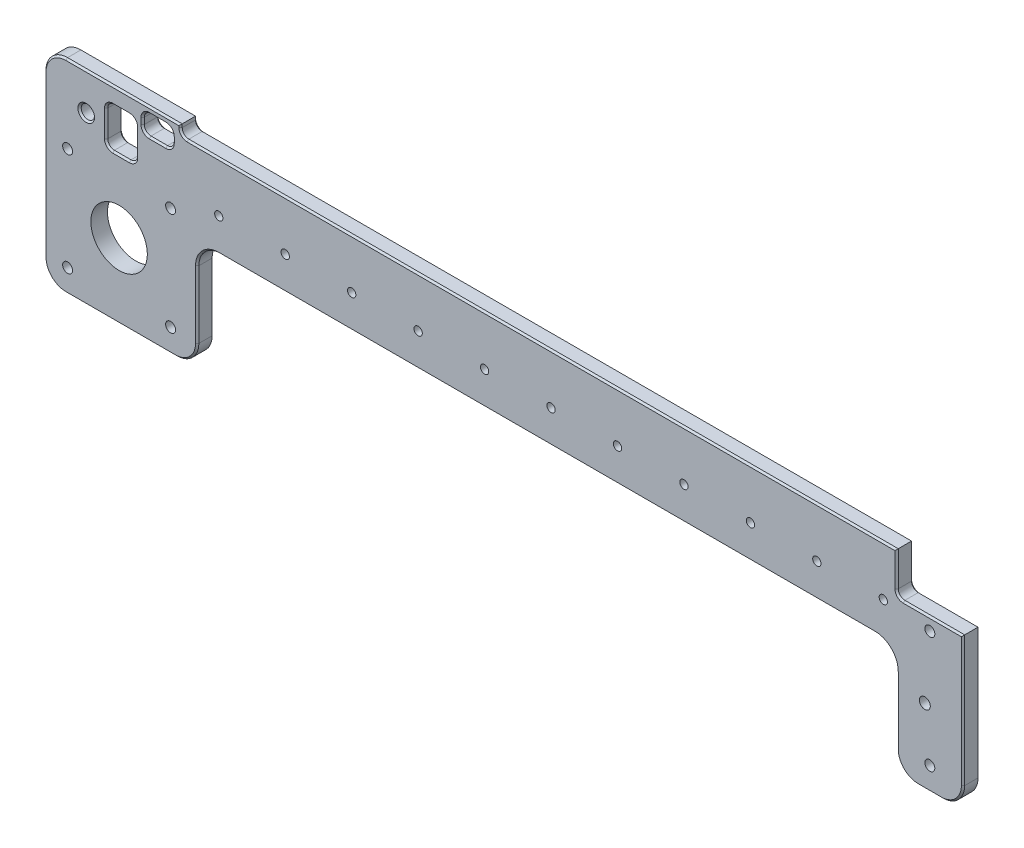
from build123d import *

# Parameters (mm, degrees)
SKETCH1_R           = 1.25
SKETCH1_R_2         = 8.5
SKETCH1_R_3         = 1.5
SKETCH1_R_4         = 1.65
SKETCH1_R_5         = 2
BOSS_EXTRUDE1_DEPTH = 5
CHAMFER1_SIZE       = 0.5


with BuildPart() as part:
    # Sketch1 → Boss-Extrude1 (new body)
    with BuildSketch(Plane.XY):
        with BuildLine():
            Line((0, -10), (197.5, -10))
            ThreePointArc((197.5, -10), (202.096194078, -11.903805922), (204, -16.5))
            Line((204, -16.5), (204, -36.746197724))
            ThreePointArc((204, -36.746197724), (205.903805922, -41.342391801), (210.5, -43.246197724))
            Line((210.5, -43.246197724), (217.5, -43.246197724))
            ThreePointArc((217.5, -43.246197724), (222.096194078, -41.342391801), (224, -36.746197724))
            Line((224, -36.746197724), (224, 2.55))
            Line((224, 2.55), (206, 2.55))
            ThreePointArc((206, 2.55), (204.585786438, 3.135786438), (204, 4.55))
            Line((204, 4.55), (204, 15))
            Line((204, 15), (-9.5, 15))
            ThreePointArc((-9.5, 15), (-10.914213562, 15.585786438), (-11.5, 17))
            Line((-11.5, 17), (-11.5, 18))
            Line((-11.5, 18), (-46, 18))
            ThreePointArc((-46, 18), (-50.596194078, 16.096194078), (-52.5, 11.5))
            Line((-52.5, 11.5), (-52.5, -36.746197724))
            ThreePointArc((-52.5, -36.746197724), (-50.596194078, -41.342391801), (-46, -43.246197724))
            Line((-46, -43.246197724), (-13, -43.246197724))
            ThreePointArc((-13, -43.246197724), (-8.403805922, -41.342391801), (-6.5, -36.746197724))
            Line((-6.5, -36.746197724), (-6.5, -16.5))
            ThreePointArc((-6.5, -16.5), (-4.596194078, -11.903805922), (0, -10))
        make_face()
        Circle(SKETCH1_R, mode=Mode.SUBTRACT)
        with Locations((20, 0)):
            Circle(SKETCH1_R, mode=Mode.SUBTRACT)
        with Locations((40, 0)):
            Circle(SKETCH1_R, mode=Mode.SUBTRACT)
        with Locations((60, 0)):
            Circle(SKETCH1_R, mode=Mode.SUBTRACT)
        with Locations((80, 0)):
            Circle(SKETCH1_R, mode=Mode.SUBTRACT)
        with Locations((100, 0)):
            Circle(SKETCH1_R, mode=Mode.SUBTRACT)
        with Locations((120, 0)):
            Circle(SKETCH1_R, mode=Mode.SUBTRACT)
        with Locations((140, 0)):
            Circle(SKETCH1_R, mode=Mode.SUBTRACT)
        with Locations((160, 0)):
            Circle(SKETCH1_R, mode=Mode.SUBTRACT)
        with Locations((180, 0)):
            Circle(SKETCH1_R, mode=Mode.SUBTRACT)
        with Locations((-30, -20.746197724)):
            Circle(SKETCH1_R_2, mode=Mode.SUBTRACT)
        with Locations((-45.5, -5.246197724)):
            Circle(SKETCH1_R_3, mode=Mode.SUBTRACT)
        with Locations((-14.5, -5.246197724)):
            Circle(SKETCH1_R_3, mode=Mode.SUBTRACT)
        with Locations((-45.5, -36.246197724)):
            Circle(SKETCH1_R_3, mode=Mode.SUBTRACT)
        with Locations((-14.5, -36.246197724)):
            Circle(SKETCH1_R_3, mode=Mode.SUBTRACT)
        with Locations((200, 0)):
            Circle(SKETCH1_R, mode=Mode.SUBTRACT)
        with Locations((212.5, -20.746197724)):
            Circle(SKETCH1_R_4, mode=Mode.SUBTRACT)
        with Locations((214, -36.246197724)):
            Circle(SKETCH1_R_3, mode=Mode.SUBTRACT)
        with Locations((214, -1.246197724)):
            Circle(SKETCH1_R_3, mode=Mode.SUBTRACT)
        with Locations((-39.9, 6.9)):
            Circle(SKETCH1_R_5, mode=Mode.SUBTRACT)
        with BuildLine():
            Line((-20.9, 16), (-15.9, 16))
            ThreePointArc((-15.9, 16), (-14.485786438, 15.414213562), (-13.9, 14))
            Line((-13.9, 14), (-13.9, 12.12))
            ThreePointArc((-13.9, 12.12), (-14.485786438, 10.705786438), (-15.9, 10.12))
            Line((-15.9, 10.12), (-20.9, 10.12))
            ThreePointArc((-20.9, 10.12), (-22.314213562, 10.705786438), (-22.9, 12.12))
            Line((-22.9, 12.12), (-22.9, 14))
            ThreePointArc((-22.9, 14), (-22.314213562, 15.414213562), (-20.9, 16))
        make_face(mode=Mode.SUBTRACT)
        with BuildLine():
            Line((-26.9, 12.9), (-31.9, 12.9))
            ThreePointArc((-31.9, 12.9), (-33.314213562, 12.314213562), (-33.9, 10.9))
            Line((-33.9, 10.9), (-33.9, 2.9))
            ThreePointArc((-33.9, 2.9), (-33.314213562, 1.485786438), (-31.9, 0.9))
            Line((-31.9, 0.9), (-26.9, 0.9))
            ThreePointArc((-26.9, 0.9), (-25.485786438, 1.485786438), (-24.9, 2.9))
            Line((-24.9, 2.9), (-24.9, 10.9))
            ThreePointArc((-24.9, 10.9), (-25.485786438, 12.314213562), (-26.9, 12.9))
        make_face(mode=Mode.SUBTRACT)
    extrude(amount=BOSS_EXTRUDE1_DEPTH)

    # Chamfer1
    chamfer1_edges = [part.edges().sort_by_distance(p)[0] for p in [
        (98.75, -10, 0),
        (-4.596194078, -11.903805922, 0),
        (-6.5, -26.623098862, 0),
        (-8.403805922, -41.342391801, 0),
        (-29.5, -43.246197724, 0),
        (-52.5, -12.623098862, 0),
        (98.75, -10, 5),
        (-4.596194078, -11.903805922, 5),
        (-6.5, -26.623098862, 5),
        (-8.403805922, -41.342391801, 5),
        (-29.5, -43.246197724, 5),
        (-52.5, -12.623098862, 5),
        (224, -17.098098862, 0),
        (222.096194078, -41.342391801, 0),
        (214, -43.246197724, 0),
        (205.903805922, -41.342391801, 0),
        (204, -26.623098862, 0),
        (202.096194078, -11.903805922, 0),
        (224, -17.098098862, 5),
        (222.096194078, -41.342391801, 5),
        (214, -43.246197724, 5),
        (205.903805922, -41.342391801, 5),
        (204, -26.623098862, 5),
        (202.096194078, -11.903805922, 5),
        (-28.75, 18, 0),
        (-28.75, 18, 5),
        (-50.596194078, 16.096194078, 0),
        (-50.596194078, 16.096194078, 5),
        (-11.5, 17.5, 0),
        (97.25, 15, 0),
        (-11.5, 17.5, 5),
        (97.25, 15, 5),
        (-18.4, 16, 5),
        (-22.314213562, 15.414213562, 5),
        (-14.485786438, 15.414213562, 5),
        (-22.9, 13.06, 5),
        (-13.9, 13.06, 5),
        (-22.314213562, 10.705786438, 5),
        (-14.485786438, 10.705786438, 5),
        (-18.4, 10.12, 5),
        (-18.4, 16, 0),
        (-22.314213562, 15.414213562, 0),
        (-14.485786438, 15.414213562, 0),
        (-22.9, 13.06, 0),
        (-13.9, 13.06, 0),
        (-22.314213562, 10.705786438, 0),
        (-14.485786438, 10.705786438, 0),
        (-18.4, 10.12, 0),
        (-50.596194078, -41.342391801, 0),
        (-50.596194078, -41.342391801, 5),
        (-10.914213562, 15.585786438, 0),
        (-10.914213562, 15.585786438, 5),
        (204, 9.775, 5),
        (204.585786438, 3.135786438, 5),
        (215, 2.55, 5),
        (215, 2.55, 0),
        (204.585786438, 3.135786438, 0),
        (204, 9.775, 0),
        (-29.4, 12.9, 0),
        (-33.314213562, 12.314213562, 0),
        (-25.485786438, 12.314213562, 0),
        (-33.9, 6.9, 0),
        (-24.9, 6.9, 0),
        (-33.314213562, 1.485786438, 0),
        (-25.485786438, 1.485786438, 0),
        (-29.4, 0.9, 0),
        (-29.4, 12.9, 5),
        (-33.314213562, 12.314213562, 5),
        (-25.485786438, 12.314213562, 5),
        (-33.9, 6.9, 5),
        (-24.9, 6.9, 5),
        (-33.314213562, 1.485786438, 5),
        (-25.485786438, 1.485786438, 5),
        (-29.4, 0.9, 5),
        (-41.9, 6.9, 5),
        (-41.9, 6.9, 0),
    ]]
    chamfer(chamfer1_edges, length=CHAMFER1_SIZE)


solid = part.part
